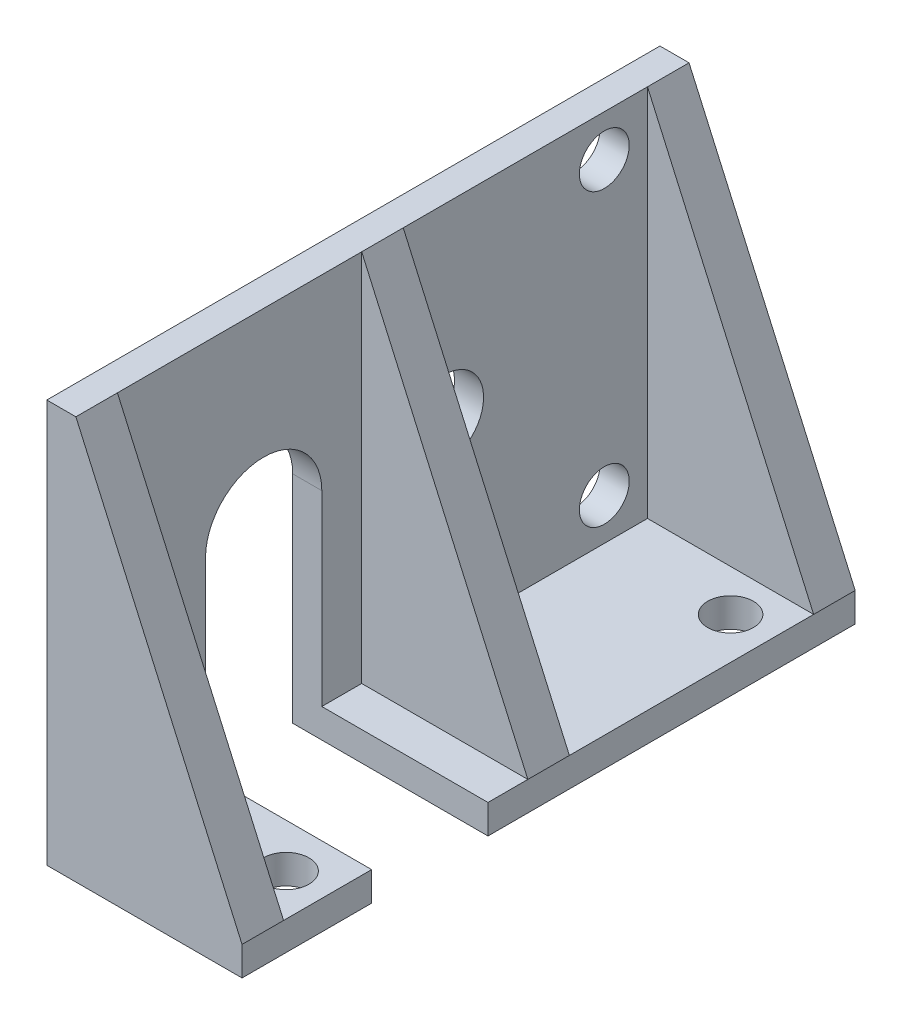
from build123d import *

# Parameters (mm, degrees)
SKETCH1_W                   = 36.9
SKETCH1_H                   = 22.5
BASEPLATE_DEPTH             = 1.75
SKETCH2_W                   = 11.75
SKETCH2_H                   = 36.9
BOSS_EXTRUDE2_DEPTH         = 1.75
SUPPORT1_REACH              = 46.788
SKETCH3_WALL_W              = 116.197196834
SKETCH3_WALL_H              = 2.5
SUPPORT3_REACH              = 33.38
SKETCH4_WALL_W              = 89.382482298
SKETCH4_WALL_H              = 2.5
SKETCH5_R                   = 1.5
MOTOR_MOUNTINGHOLES_DEPTH   = 45.360568076
SHAFTSLOT_DEPTH             = 45.787526165
SKETCH8_R                   = 1.375
CHASSIS_MOUNTINGHOLES_DEPTH = 45.787526165
SKETCH9_R                   = 2.35
INDENTHOLE_DEPTH            = 10


with BuildPart() as part:
    # Sketch1 → basePlate (new body)
    with BuildSketch(Plane(origin=(0, 0, 0), x_dir=(0, 0, -1), z_dir=(1, 0, 0))):
        with Locations((18.45, 11.25)):
            Rectangle(SKETCH1_W, SKETCH1_H)
    extrude(amount=BASEPLATE_DEPTH)

    # Sketch2 → Boss-Extrude2 (add)
    with BuildSketch(Plane.XZ):
        with Locations((5.875, -18.45)):
            Rectangle(SKETCH2_W, SKETCH2_H)
    extrude(amount=BOSS_EXTRUDE2_DEPTH)

    # Sketch3 wall → support1 (add, up to next)
    with BuildSketch(Plane(origin=(6.75, 11.25, 0), x_dir=(0.406138466053, -0.91381154862, 0), z_dir=(0.91381154862, 0.406138466053, 0)), mode=Mode.PRIVATE) as support1_sk1:
        with Locations((0, 1.25)):
            Rectangle(SKETCH3_WALL_W, SKETCH3_WALL_H)
    support1_tool1 = extrude(support1_sk1.sketch, amount=-SUPPORT1_REACH, mode=Mode.PRIVATE) - part.part
    support1 = support1_tool1.solids().sort_by_distance((6.75, 11.25, 0))[0]
    add(support1)

    # support2: support1 across plane
    add(support1.mirror(Plane.XY.offset(-18.45)))

    # Sketch4 wall → support3 (add, up to next)
    with BuildSketch(Plane(origin=(6.75, 11.25, -18.45), x_dir=(0.406138466053, -0.91381154862, 0), z_dir=(0.91381154862, 0.406138466053, 0)), mode=Mode.PRIVATE) as support3_sk1:
        Rectangle(SKETCH4_WALL_W, SKETCH4_WALL_H)
    support3_tool1 = extrude(support3_sk1.sketch, amount=-SUPPORT3_REACH, mode=Mode.PRIVATE) - part.part
    add(support3_tool1.solids().sort_by_distance((6.75, 11.25, -18.45))[0])

    # Sketch5 → motor_mountingHoles (cut, through all)
    with BuildSketch(Plane(origin=(1.75, 0, 0), x_dir=(0, 0, -1), z_dir=(1, 0, 0))):
        with Locations((31.8, 2.5)):
            Circle(SKETCH5_R)
        with Locations((31.8, 20)):
            Circle(SKETCH5_R)
    extrude(amount=-MOTOR_MOUNTINGHOLES_DEPTH, mode=Mode.SUBTRACT)

    # Sketch7 → shaftSlot (cut, through all)
    with BuildSketch(Plane(origin=(11.75, 0, 0), x_dir=(0, 0, -1), z_dir=(1, 0, 0))):
        with BuildLine():
            Line((7.8, -1.75), (7.8, 11.25))
            ThreePointArc((7.8, 11.25), (11.3, 14.75), (14.8, 11.25))
            Line((14.8, 11.25), (14.8, -1.75))
            Line((14.8, -1.75), (7.8, -1.75))
        make_face()
    extrude(amount=-SHAFTSLOT_DEPTH, mode=Mode.SUBTRACT)

    # Sketch8 → chassis_mountingHoles (cut, through all)
    with BuildSketch(Plane(origin=(0, 0, 0), x_dir=(1, 0, 0), z_dir=(0, 1, 0))):
        with Locations((9.25, 5.15)):
            Circle(SKETCH8_R)
        with Locations((9.25, 31.9)):
            Circle(SKETCH8_R)
        with Locations((4.25, 22.2)):
            Circle(SKETCH8_R)
    extrude(amount=-CHASSIS_MOUNTINGHOLES_DEPTH, mode=Mode.SUBTRACT)

    # Sketch9 → indentHole (cut)
    with BuildSketch(Plane(origin=(1.75, 0, 0), x_dir=(0, 0, -1), z_dir=(1, 0, 0))):
        with Locations((22.185, 11.25)):
            Circle(SKETCH9_R)
    extrude(amount=-INDENTHOLE_DEPTH, mode=Mode.SUBTRACT)


solid = part.part
